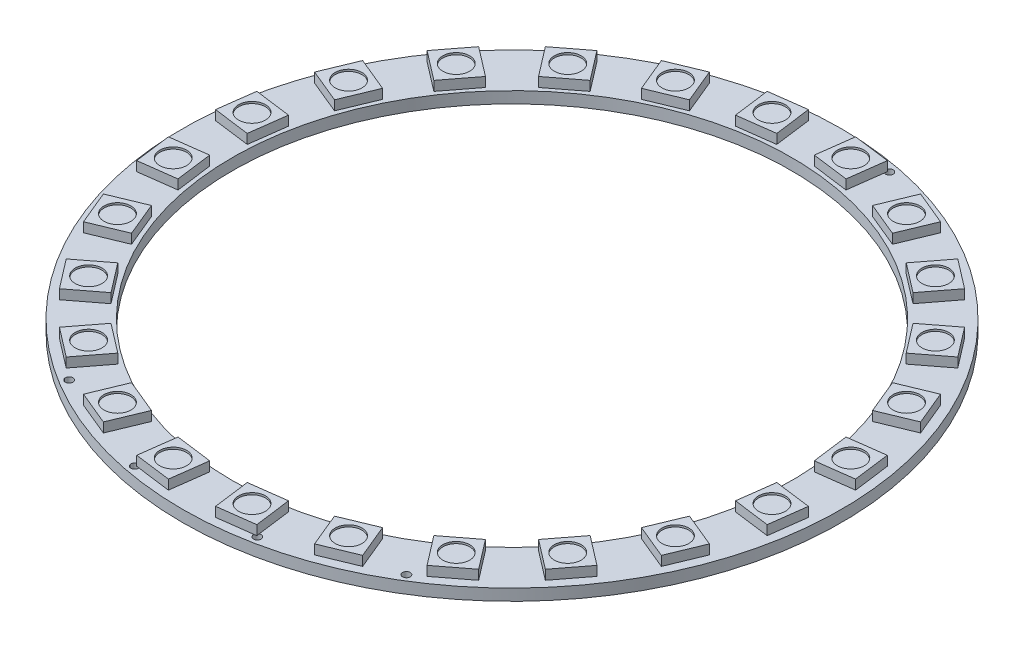
from build123d import *

# Parameters (mm, degrees)
BOSS_EXTRUDE1_OUTLINE_R   = 43
BOSS_EXTRUDE1_OUTLINE_R_2 = 0.5
BOSS_EXTRUDE1_OUTLINE_R_3 = 36.5
BOSS_EXTRUDE1_DEPTH       = 1.5
BOSS_EXTRUDE2_DEPTH       = 1.25
SKETCH4_R                 = 1.75
CUT_EXTRUDE1_DEPTH        = 0.25
CIRPATTERN1_COUNT         = 24


# Read off the part's stored shape, not the designer's step: Boss-Extrude1
with BuildPart() as part:
    # Boss-Extrude1 outline → Boss-Extrude1 (new body)
    with BuildSketch(Plane(origin=(0, 0, 0), x_dir=(1, 0, 0), z_dir=(0, 1, 0))):
        Circle(BOSS_EXTRUDE1_OUTLINE_R)
        with Locations((-22, -35.77708764)):
            Circle(BOSS_EXTRUDE1_OUTLINE_R_2, mode=Mode.SUBTRACT)
        with Locations((-8, -41.231056256)):
            Circle(BOSS_EXTRUDE1_OUTLINE_R_2, mode=Mode.SUBTRACT)
        with Locations((8, -41.231056256)):
            Circle(BOSS_EXTRUDE1_OUTLINE_R_2, mode=Mode.SUBTRACT)
        with Locations((22, -35.77708764)):
            Circle(BOSS_EXTRUDE1_OUTLINE_R_2, mode=Mode.SUBTRACT)
        with Locations((-8, 41.231056256)):
            Circle(BOSS_EXTRUDE1_OUTLINE_R_2, mode=Mode.SUBTRACT)
        Circle(BOSS_EXTRUDE1_OUTLINE_R_3, mode=Mode.SUBTRACT)
        with Locations((8, 41.231056256)):
            Circle(BOSS_EXTRUDE1_OUTLINE_R_2, mode=Mode.SUBTRACT)
    extrude(amount=BOSS_EXTRUDE1_DEPTH)


with BuildPart() as body_2:
    # Sketch2 → Boss-Extrude2 (new body)
    with BuildSketch(Plane(origin=(0, 1.5, 0), x_dir=(1, 0, 0), z_dir=(0, 1, 0))):
        Polygon((3.076527168, 41.755658067), (2.450001445, 36.996722732), (7.208936779, 36.37019701), (7.835462502, 41.129132344), align=None)
    extrude(amount=BOSS_EXTRUDE2_DEPTH)

    # Sketch4 → Cut-Extrude1 (cut)
    with BuildSketch(Plane(origin=(0, 2.75, 0), x_dir=(1, 0, 0), z_dir=(0, 1, 0))):
        with Locations(Location((5.142731973, 39.062927538, 0), (0, 0, 270))):
            Circle(SKETCH4_R)
    extrude(amount=-CUT_EXTRUDE1_DEPTH, mode=Mode.SUBTRACT)


with BuildPart() as cirpattern1_1:
    # CirPattern1: pattern copy
    add(body_2.part.rotate(Axis((0, 0, 0), (0, 1, 0)), 1 * 360 / CIRPATTERN1_COUNT))


with BuildPart() as cirpattern1_2:
    # CirPattern1: pattern copy
    add(body_2.part.rotate(Axis((0, 0, 0), (0, 1, 0)), 2 * 360 / CIRPATTERN1_COUNT))


with BuildPart() as cirpattern1_3:
    # CirPattern1: pattern copy
    add(body_2.part.rotate(Axis((0, 0, 0), (0, 1, 0)), 3 * 360 / CIRPATTERN1_COUNT))


with BuildPart() as cirpattern1_4:
    # CirPattern1: pattern copy
    add(body_2.part.rotate(Axis((0, 0, 0), (0, 1, 0)), 4 * 360 / CIRPATTERN1_COUNT))


with BuildPart() as cirpattern1_5:
    # CirPattern1: pattern copy
    add(body_2.part.rotate(Axis((0, 0, 0), (0, 1, 0)), 5 * 360 / CIRPATTERN1_COUNT))


with BuildPart() as cirpattern1_6:
    # CirPattern1: pattern copy
    add(body_2.part.rotate(Axis((0, 0, 0), (0, 1, 0)), 6 * 360 / CIRPATTERN1_COUNT))


with BuildPart() as cirpattern1_7:
    # CirPattern1: pattern copy
    add(body_2.part.rotate(Axis((0, 0, 0), (0, 1, 0)), 7 * 360 / CIRPATTERN1_COUNT))


with BuildPart() as cirpattern1_8:
    # CirPattern1: pattern copy
    add(body_2.part.rotate(Axis((0, 0, 0), (0, 1, 0)), 8 * 360 / CIRPATTERN1_COUNT))


with BuildPart() as cirpattern1_9:
    # CirPattern1: pattern copy
    add(body_2.part.rotate(Axis((0, 0, 0), (0, 1, 0)), 9 * 360 / CIRPATTERN1_COUNT))


with BuildPart() as cirpattern1_10:
    # CirPattern1: pattern copy
    add(body_2.part.rotate(Axis((0, 0, 0), (0, 1, 0)), 10 * 360 / CIRPATTERN1_COUNT))


with BuildPart() as cirpattern1_11:
    # CirPattern1: pattern copy
    add(body_2.part.rotate(Axis((0, 0, 0), (0, 1, 0)), 11 * 360 / CIRPATTERN1_COUNT))


with BuildPart() as cirpattern1_12:
    # CirPattern1: pattern copy
    add(body_2.part.rotate(Axis((0, 0, 0), (0, 1, 0)), 12 * 360 / CIRPATTERN1_COUNT))


with BuildPart() as cirpattern1_13:
    # CirPattern1: pattern copy
    add(body_2.part.rotate(Axis((0, 0, 0), (0, 1, 0)), 13 * 360 / CIRPATTERN1_COUNT))


with BuildPart() as cirpattern1_14:
    # CirPattern1: pattern copy
    add(body_2.part.rotate(Axis((0, 0, 0), (0, 1, 0)), 14 * 360 / CIRPATTERN1_COUNT))


with BuildPart() as cirpattern1_15:
    # CirPattern1: pattern copy
    add(body_2.part.rotate(Axis((0, 0, 0), (0, 1, 0)), 15 * 360 / CIRPATTERN1_COUNT))


with BuildPart() as cirpattern1_16:
    # CirPattern1: pattern copy
    add(body_2.part.rotate(Axis((0, 0, 0), (0, 1, 0)), 16 * 360 / CIRPATTERN1_COUNT))


with BuildPart() as cirpattern1_17:
    # CirPattern1: pattern copy
    add(body_2.part.rotate(Axis((0, 0, 0), (0, 1, 0)), 17 * 360 / CIRPATTERN1_COUNT))


with BuildPart() as cirpattern1_18:
    # CirPattern1: pattern copy
    add(body_2.part.rotate(Axis((0, 0, 0), (0, 1, 0)), 18 * 360 / CIRPATTERN1_COUNT))


with BuildPart() as cirpattern1_19:
    # CirPattern1: pattern copy
    add(body_2.part.rotate(Axis((0, 0, 0), (0, 1, 0)), 19 * 360 / CIRPATTERN1_COUNT))


with BuildPart() as cirpattern1_20:
    # CirPattern1: pattern copy
    add(body_2.part.rotate(Axis((0, 0, 0), (0, 1, 0)), 20 * 360 / CIRPATTERN1_COUNT))


with BuildPart() as cirpattern1_21:
    # CirPattern1: pattern copy
    add(body_2.part.rotate(Axis((0, 0, 0), (0, 1, 0)), 21 * 360 / CIRPATTERN1_COUNT))


with BuildPart() as cirpattern1_22:
    # CirPattern1: pattern copy
    add(body_2.part.rotate(Axis((0, 0, 0), (0, 1, 0)), 22 * 360 / CIRPATTERN1_COUNT))


with BuildPart() as cirpattern1_23:
    # CirPattern1: pattern copy
    add(body_2.part.rotate(Axis((0, 0, 0), (0, 1, 0)), 23 * 360 / CIRPATTERN1_COUNT))


solid = Compound([part.part, body_2.part, cirpattern1_1.part, cirpattern1_2.part, cirpattern1_3.part, cirpattern1_4.part, cirpattern1_5.part, cirpattern1_6.part, cirpattern1_7.part, cirpattern1_8.part, cirpattern1_9.part, cirpattern1_10.part, cirpattern1_11.part, cirpattern1_12.part, cirpattern1_13.part, cirpattern1_14.part, cirpattern1_15.part, cirpattern1_16.part, cirpattern1_17.part, cirpattern1_18.part, cirpattern1_19.part, cirpattern1_20.part, cirpattern1_21.part, cirpattern1_22.part, cirpattern1_23.part])
